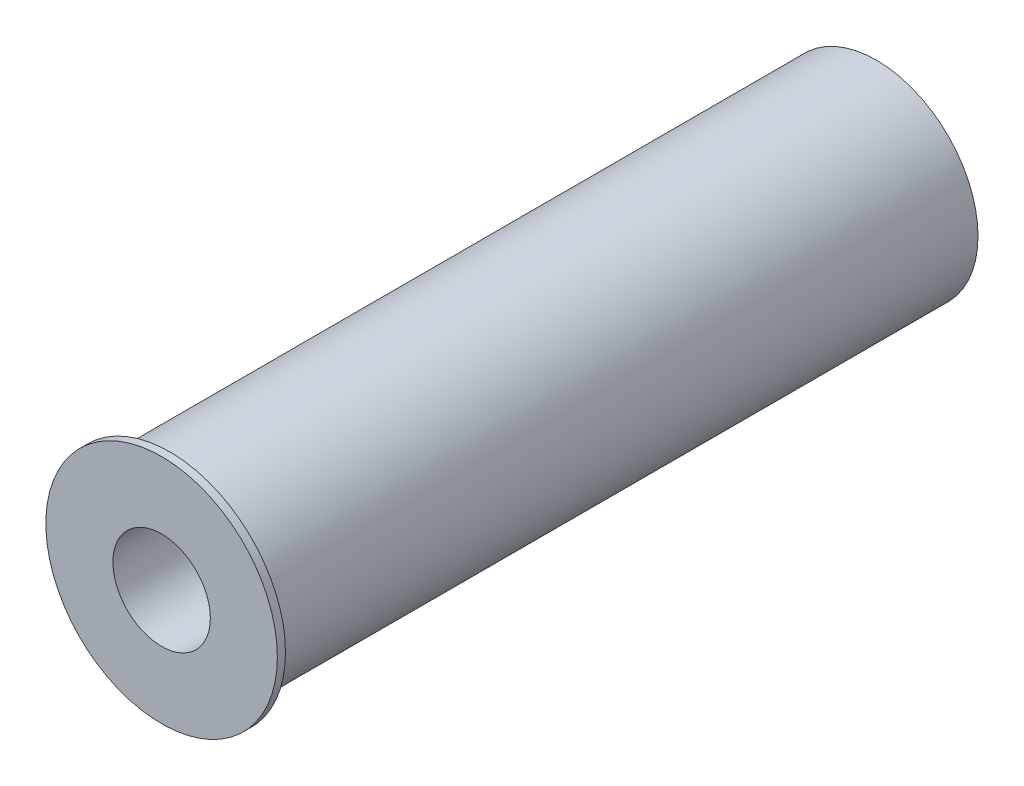
from build123d import *

# Parameters (mm, degrees)
SKIZZE1_R                       = 12.5
SKIZZE1_R_2                     = 6
AUFSATZ_LINEAR_AUSTRAGEN1_DEPTH = 87
SKIZZE2_R                       = 14.25
SKIZZE2_R_2                     = 6
AUFSATZ_LINEAR_AUSTRAGEN2_DEPTH = 1
SKIZZE3_R                       = 1.65
SCHNITT_LINEAR_AUSTRAGEN1_DEPTH = 15


with BuildPart() as part:
    # Skizze1 → Aufsatz-Linear austragen1 (new body)
    with BuildSketch(Plane.XY):
        Circle(SKIZZE1_R)
        Circle(SKIZZE1_R_2, mode=Mode.SUBTRACT)
    extrude(amount=AUFSATZ_LINEAR_AUSTRAGEN1_DEPTH)

    # Skizze2 → Aufsatz-Linear austragen2 (add)
    with BuildSketch(Plane.XY.offset(87)):
        Circle(SKIZZE2_R)
        Circle(SKIZZE2_R_2, mode=Mode.SUBTRACT)
    extrude(amount=AUFSATZ_LINEAR_AUSTRAGEN2_DEPTH)

    # Skizze3 → Schnitt-Linear austragen1 (cut)
    with BuildSketch(Plane(origin=(0, 0, 0), x_dir=(-1, 0, 0), z_dir=(0, 0, -1))):
        with Locations((9.25, 0)):
            Circle(SKIZZE3_R)
        with Locations((4.625, -8.010734985)):
            Circle(SKIZZE3_R)
        with Locations((-4.625, -8.010734985)):
            Circle(SKIZZE3_R)
        with Locations((-9.25, 0)):
            Circle(SKIZZE3_R)
        with Locations((-4.625, 8.010734985)):
            Circle(SKIZZE3_R)
        with Locations((4.625, 8.010734985)):
            Circle(SKIZZE3_R)
    extrude(amount=-SCHNITT_LINEAR_AUSTRAGEN1_DEPTH, mode=Mode.SUBTRACT)


solid = part.part
